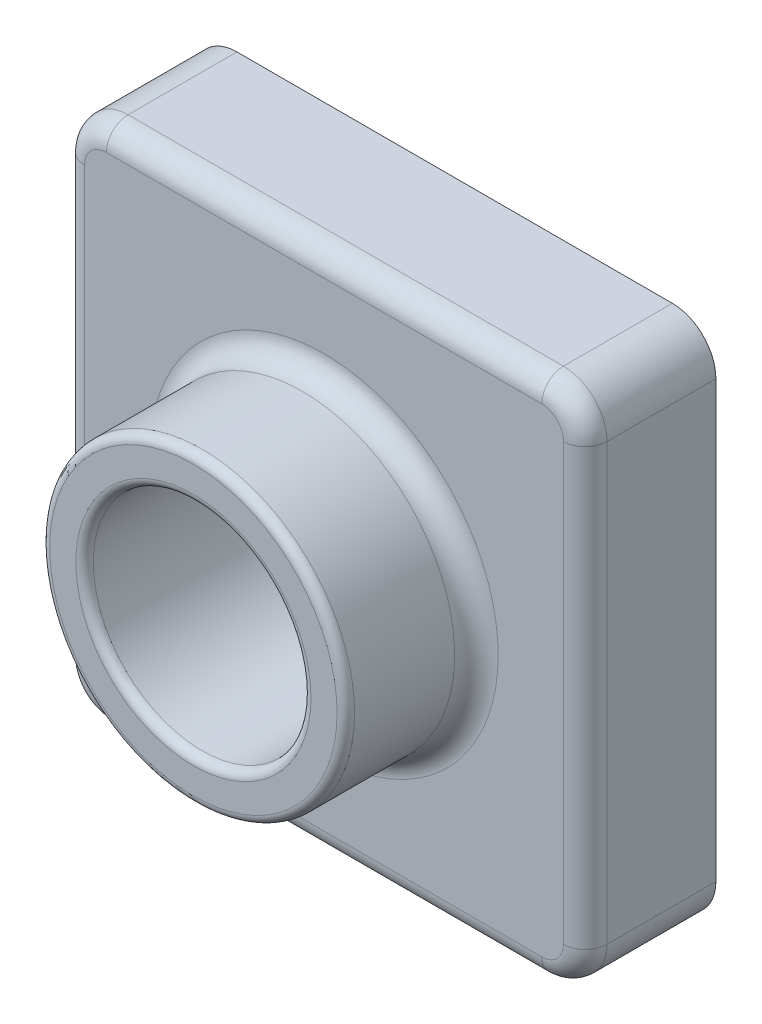
from build123d import *

# Parameters (mm, degrees)
CROQUIS1_W              = 120
CROQUIS1_H              = 120
SALIENTE_EXTRUIR1_DEPTH = 30
CROQUIS3_R              = 35
SALIENTE_EXTRUIR2_DEPTH = 30
CROQUIS4_R              = 25
CORTAR_EXTRUIR1_DEPTH   = 60
REDONDEO4_R             = 2
REDONDEO6_R             = 10
REDONDEO8_R             = 5
VACIADO1_T              = -2


with BuildPart() as part:
    # Croquis1 → Saliente-Extruir1 (new body)
    with BuildSketch(Plane.XY):
        with Locations((60, 60)):
            Rectangle(CROQUIS1_W, CROQUIS1_H)
    extrude(amount=SALIENTE_EXTRUIR1_DEPTH)

    # Croquis3 → Saliente-Extruir2 (add)
    with BuildSketch(Plane.XY.offset(30)):
        with Locations(Location((60, 60, 0), (0, 0, 180))):
            Circle(CROQUIS3_R)
    extrude(amount=SALIENTE_EXTRUIR2_DEPTH)

    # Croquis4 → Cortar-Extruir1 (cut)
    with BuildSketch(Plane.XY.offset(60)):
        with Locations((60, 60)):
            Circle(CROQUIS4_R)
    extrude(amount=-CORTAR_EXTRUIR1_DEPTH, mode=Mode.SUBTRACT)

    # Redondeo4
    redondeo4_edges = [part.edges().sort_by_distance(p)[0] for p in [
        (95, 60, 60),
        (35, 60, 60),
    ]]
    fillet(redondeo4_edges, radius=REDONDEO4_R)

    # Redondeo6
    redondeo6_edges = [part.edges().sort_by_distance(p)[0] for p in [
        (0, 120, 15),
        (120, 120, 15),
        (120, 0, 15),
        (0, 0, 15),
    ]]
    fillet(redondeo6_edges, radius=REDONDEO6_R)

    # Redondeo8
    redondeo8_edges = [part.edges().sort_by_distance(p)[0] for p in [
        (95, 60, 30),
        (120, 60, 30),
        (60, 0, 30),
        (0, 60, 30),
        (60, 120, 30),
        (117.071067812, 117.071067812, 30),
        (2.928932188, 117.071067812, 30),
        (2.928932188, 2.928932188, 30),
        (117.071067812, 2.928932188, 30),
    ]]
    fillet(redondeo8_edges, radius=REDONDEO8_R)

    # Vaciado1
    vaciado1_openings = [part.faces().sort_by_distance(p)[0] for p in [
        (60, 1.697056275, 0),
    ]]
    offset(amount=VACIADO1_T, openings=vaciado1_openings, kind=Kind.INTERSECTION)


solid = part.part
